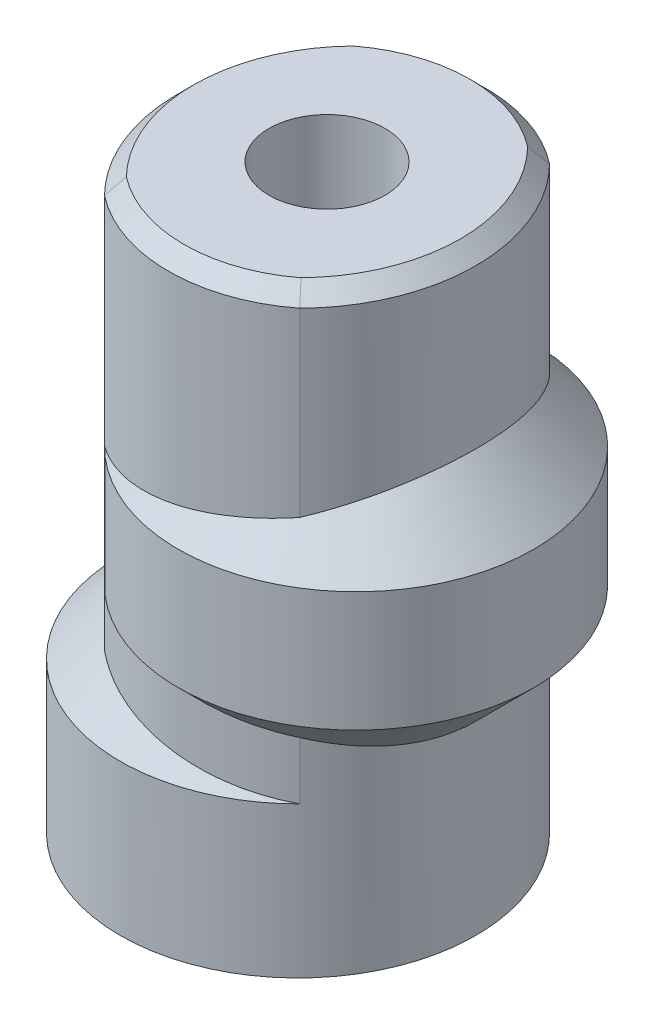
from build123d import *

# Parameters (mm, degrees)
BOSS_EXTRUDE1_DEPTH = 15.4
CUT_EXTRUDE1_DEPTH  = 11.8
CUT_EXTRUDE2_REACH  = 18.939
SKETCH5_R           = 1.5
CHAMFER1_SIZE       = 0.4


with BuildPart() as part:
    # Sketch1 → Boss-Extrude1 (new body)
    with BuildSketch(Plane(origin=(0, 0, 0), x_dir=(1, 0, 0), z_dir=(0, 1, 0))):
        with BuildLine():
            ThreePointArc((-2.525, -3.23022832), (0, -4.1), (2.525, -3.23022832))
            ThreePointArc((2.525, -3.23022832), (3.85, 0), (2.525, 3.23022832))
            ThreePointArc((2.525, 3.23022832), (0, 4.1), (-2.525, 3.23022832))
            ThreePointArc((-2.525, 3.23022832), (-3.85, 0), (-2.525, -3.23022832))
        make_face()
    extrude(amount=BOSS_EXTRUDE1_DEPTH)

    # Sketch2 → Revolve1 (revolve)
    with BuildSketch(Plane.XY, mode=Mode.PRIVATE) as revolve1_sk:
        Polygon((3.85, 0), (3.85, 3.9), (2.35, 5.4), (-0.75, 5.4), (-0.75, 0), align=None)
    revolve(revolve1_sk.sketch.rotate(Axis((-0.75, 5.4, 0), (0, -1, 0)), 270), axis=Axis((-0.75, 5.4, 0), (0, -1, 0)))

    # Sketch3 → Revolve2 (revolve)
    with BuildSketch(Plane.XY, mode=Mode.PRIVATE) as revolve2_sk:
        Polygon((0.75, 4.8), (-2.35, 4.8), (-3.85, 6.3), (-3.85, 9.4), (-2.35, 10.9), (0.75, 10.9), align=None)
    revolve(revolve2_sk.sketch.rotate(Axis((0.75, 4.8, 0), (0, 1, 0)), 315.394327097), axis=Axis((0.75, 4.8, 0), (0, 1, 0)))

    # Sketch4 → Cut-Extrude1 (cut)
    with BuildSketch(Plane.XZ):
        with BuildLine():
            Line((-2, -2), (2, -2))
            ThreePointArc((2, -2), (2.465465068, -1.682598659), (2.339973189, -1.133369081))
            ThreePointArc((2.339973189, -1.133369081), (0, 2.6), (-2.339973189, -1.133369081))
            ThreePointArc((-2.339973189, -1.133369081), (-2.465465068, -1.682598659), (-2, -2))
        make_face()
    extrude(amount=-CUT_EXTRUDE1_DEPTH, mode=Mode.SUBTRACT)

    # Sketch5 → Cut-Extrude2 (cut, up to next)
    with BuildSketch(Plane(origin=(0, 15.4, 0), x_dir=(1, 0, 0), z_dir=(0, 1, 0)), mode=Mode.PRIVATE) as cut_extrude2_sk1:
        with Locations(Location((0, 0, 0), (0, 0, 270))):
            Circle(SKETCH5_R)
    cut_extrude2_tool1 = extrude(cut_extrude2_sk1.sketch, amount=-CUT_EXTRUDE2_REACH, mode=Mode.PRIVATE) & part.part
    add(cut_extrude2_tool1.solids().sort_by_distance((0, 15.4, 0))[0], mode=Mode.SUBTRACT)

    # Chamfer1
    # the kernel refuses this chamfer: 0.4 mm, written as the material it takes off along each edge
    with BuildSketch(Plane(origin=(0, 15.4, 0), x_dir=(-0.7922190522423981, 0, 0.6102368173620439), z_dir=(-0.6102368173620439, 0, -0.7922190522423981))) as chamfer1_piece_1:
        Polygon((4.1 - CHAMFER1_SIZE, 0), (4.1, -CHAMFER1_SIZE), (4.1, 0), align=None)
    revolve(axis=Axis((0, 15.4, 0), (0, 1, 0)), revolution_arc=104.786743256, mode=Mode.SUBTRACT)
    with BuildSketch(Plane(origin=(-0.75, 15.4, 0), x_dir=(0.5384255548923128, 0, 0.8426730812354843), z_dir=(-0.8426730812354843, 0, 0.5384255548923128))) as chamfer1_piece_2:
        Polygon((4.6 - CHAMFER1_SIZE, 0), (4.6, -CHAMFER1_SIZE), (4.6, 0), align=None)
    revolve(axis=Axis((-0.75, 15.4, 0), (0, 1, 0)), revolution_arc=114.846952535, mode=Mode.SUBTRACT)
    with BuildSketch(Plane(origin=(0, 15.4, 0), x_dir=(0.7922190522423987, 0, -0.610236817362043), z_dir=(0.610236817362043, 0, 0.7922190522423987))) as chamfer1_piece_3:
        Polygon((4.1 - CHAMFER1_SIZE, 0), (4.1, -CHAMFER1_SIZE), (4.1, 0), align=None)
    revolve(axis=Axis((0, 15.4, 0), (0, 1, 0)), revolution_arc=104.786743256, mode=Mode.SUBTRACT)
    with BuildSketch(Plane(origin=(0.75, 15.4, 0), x_dir=(-0.5384255548923127, 0, -0.8426730812354845), z_dir=(0.8426730812354845, 0, -0.5384255548923127))) as chamfer1_piece_4:
        Polygon((4.6 - CHAMFER1_SIZE, 0), (4.6, -CHAMFER1_SIZE), (4.6, 0), align=None)
    revolve(axis=Axis((0.75, 15.4, 0), (0, 1, 0)), revolution_arc=114.846952535, mode=Mode.SUBTRACT)


solid = part.part
